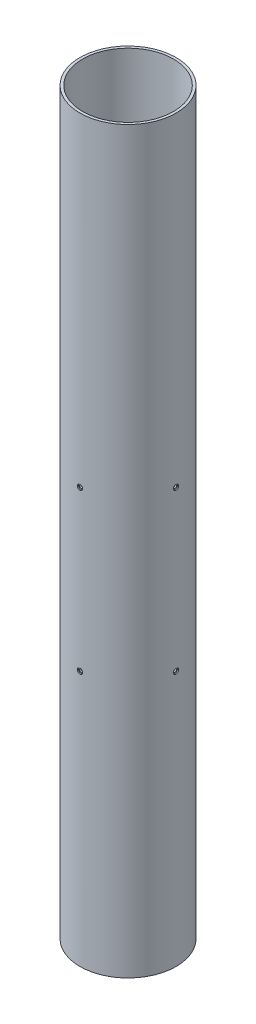
from build123d import *

# Parameters (mm, degrees)
SKETCH1_R            = 53.721
SKETCH1_R_2          = 50.8
TUBE_EXTRUSION_DEPTH = 825.5
BULKHEAD_HOLES_REACH = 836.194
SKETCH3_R            = 1.6383
HOLE_PATTERN_COUNT   = 4
SKETCH4_R            = 2.9083
SKETCH4_R_2          = 1.6383
CUT_EXTRUDE1_DEPTH   = 1.27
CIRPATTERN1_COUNT    = 4


with BuildPart() as part:
    # Sketch1 → Tube Extrusion (new body)
    with BuildSketch(Plane(origin=(0, 0, 0), x_dir=(1, 0, 0), z_dir=(0, 1, 0))):
        Circle(SKETCH1_R)
        Circle(SKETCH1_R_2, mode=Mode.SUBTRACT)
    extrude(amount=TUBE_EXTRUSION_DEPTH)

    # Sketch3 → Bulkhead Holes (cut, up to next)
    with BuildSketch(Plane.XY.offset(53.721), mode=Mode.PRIVATE) as bulkhead_holes_sk1:
        with Locations((0, 463.55)):
            Circle(SKETCH3_R)
    bulkhead_holes_tool1 = extrude(bulkhead_holes_sk1.sketch, amount=-BULKHEAD_HOLES_REACH, mode=Mode.PRIVATE) & part.part
    # Sketch3 → Bulkhead Holes (cut, up to next)
    with BuildSketch(Plane.XY.offset(53.721), mode=Mode.PRIVATE) as bulkhead_holes_sk2:
        with Locations((0, 285.75)):
            Circle(SKETCH3_R)
    bulkhead_holes_tool2 = extrude(bulkhead_holes_sk2.sketch, amount=-BULKHEAD_HOLES_REACH, mode=Mode.PRIVATE) & part.part
    bulkhead_holes_1 = bulkhead_holes_tool1.solids().sort_by_distance((0, 463.55, 53.721))[0]
    add(bulkhead_holes_1, mode=Mode.SUBTRACT)
    bulkhead_holes_2 = bulkhead_holes_tool2.solids().sort_by_distance((0, 285.75, 53.721))[0]
    add(bulkhead_holes_2, mode=Mode.SUBTRACT)
    bulkhead_holes = bulkhead_holes_1 + bulkhead_holes_2  # Bulkhead Holes as one shape, for the pattern or mirror that repeats it

    # Hole Pattern: Bulkhead Holes ×4 about axis
    hole_pattern_axis = Axis((0, 825.5, 0), (0, -1, 0))
    for i in range(1, HOLE_PATTERN_COUNT):
        add(bulkhead_holes.rotate(hole_pattern_axis, i * 360 / HOLE_PATTERN_COUNT), mode=Mode.SUBTRACT)

    # Sketch4 → Cut-Extrude1 (cut)
    # profile 1 of 2: a face of its own
    with BuildSketch(Plane.XY.offset(53.721)):
        with Locations((0, 463.55)):
            Circle(SKETCH4_R)
        with Locations((0, 463.55)):
            Circle(SKETCH4_R_2, mode=Mode.SUBTRACT)
    # profile 2 of 2: a face of its own
    with BuildSketch(Plane.XY.offset(53.721)):
        with Locations((0, 285.75)):
            Circle(SKETCH4_R)
        with Locations((0, 285.75)):
            Circle(SKETCH4_R_2, mode=Mode.SUBTRACT)
    cut_extrude1 = extrude(amount=-CUT_EXTRUDE1_DEPTH, mode=Mode.SUBTRACT)

    # CirPattern1: Cut-Extrude1 ×4 about axis
    cirpattern1_axis = Axis((0, 825.5, 0), (0, -1, 0))
    for i in range(1, CIRPATTERN1_COUNT):
        add(cut_extrude1.rotate(cirpattern1_axis, i * 360 / CIRPATTERN1_COUNT), mode=Mode.SUBTRACT)


solid = part.part
